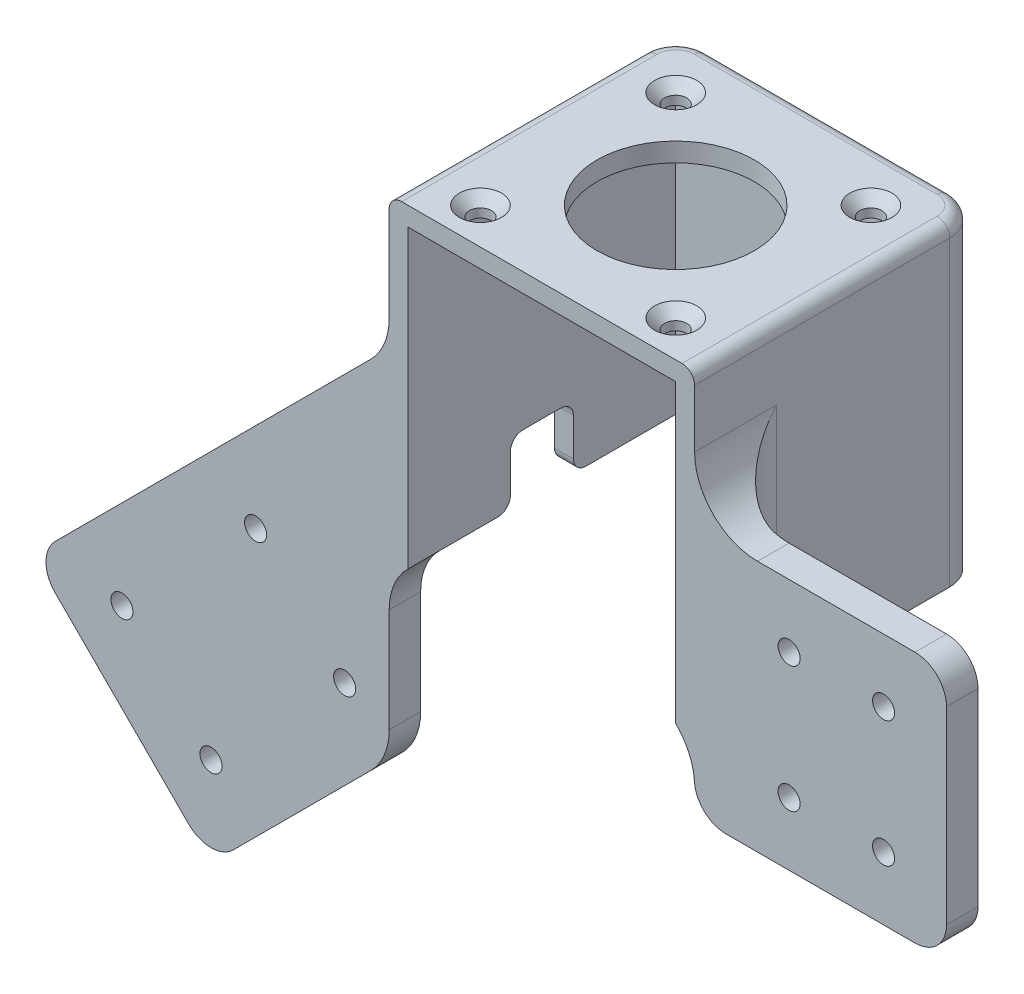
from build123d import *

# Parameters (mm, degrees)
SKETCH1_W                     = 48.5
SKETCH1_H                     = 45.5
BOSS_EXTRUDE1_DEPTH           = 3
BOSS_EXTRUDE2_DEPTH           = 47
SKETCH3_W                     = 5
SKETCH3_H                     = 40
BOSS_EXTRUDE3_DEPTH           = 40
BOSS_EXTRUDE4_DEPTH           = 5
FILLET1_R                     = 8
SKETCH5_R                     = 1.75
SKETCH5_R_2                   = 12.5
CUT_EXTRUDE1_DEPTH            = 134.19002114
SKETCH7_R                     = 1.75
CUT_EXTRUDE2_DEPTH            = 138.083074197
BODY_MOVE_COPY1_START         = -20.75
BODY_MOVE_COPY1_OUTLINE_R     = 1.75
BODY_MOVE_COPY1_DEPTH         = 45
BODY_MOVE_COPY1_START_2       = -33.75
BODY_MOVE_COPY1_2_OUTLINE_R   = 1.75
BODY_MOVE_COPY1_2_DEPTH       = 12.5
BODY_MOVE_COPY1_START_3       = -66.25
BODY_MOVE_COPY1_3_DEPTH       = 36.7500001
BODY_MOVE_COPY1_4_OUTLINE_W   = 42.5
BODY_MOVE_COPY1_4_OUTLINE_H   = 47
BODY_MOVE_COPY1_4_DEPTH       = 3
BODY_MOVE_COPY1_START_4       = -104
BODY_MOVE_COPY1_5_OUTLINE_R   = 1.75
BODY_MOVE_COPY1_5_OUTLINE_R_2 = 12.5
BODY_MOVE_COPY1_5_DEPTH       = 107
BODY_MOVE_COPY1_START_5       = -87.255885421
BODY_MOVE_COPY1_6_DEPTH       = 40.255885421
FILLET2_R                     = 5
FILLET3_START                 = -28.2363
FILLET3_DEPTH                 = 7.4863
FILLET3_START_2               = -33.7500001
FILLET3_2_DEPTH               = 13.0000001
FILLET3_START_3               = -25.75
FILLET3_3_DEPTH               = 5
FILLET3_4_DEPTH               = 8.4719001
FILLET3_START_4               = -47.0000001
FILLET3_5_DEPTH               = 40.0000001
FILLET4_R                     = 5
FILLET5_R                     = 5
FILLET6_R                     = 2
SKETCH8_W                     = 10
SKETCH8_H                     = 10
CUT_EXTRUDE3_DEPTH            = 148.975084215
FILLET7_R                     = 2
CHAMFER1_SIZE                 = 1.6
CHAMFER2_SIZE                 = 1.6


with BuildPart() as part:
    # Sketch1 → Boss-Extrude1 (new body)
    with BuildSketch(Plane(origin=(0, 0, 0), x_dir=(1, 0, 0), z_dir=(0, 1, 0))):
        with Locations((0, -1.5)):
            Rectangle(SKETCH1_W, SKETCH1_H)
    extrude(amount=BOSS_EXTRUDE1_DEPTH)

    # Sketch2 → Boss-Extrude2 (add)
    with BuildSketch(Plane.XZ):
        Polygon((-21.25, 21.25), (21.25, 21.25), (21.25, -21.25), (24.25, -21.25), (24.25, 24.25), (-24.25, 24.25), (-24.25, -21.25), (-21.25, -21.25), align=None)
    extrude(amount=BOSS_EXTRUDE2_DEPTH)

    # Sketch3 → Boss-Extrude3 (add)
    with BuildSketch(Plane(origin=(24.25, 0, 0), x_dir=(0, 0, -1), z_dir=(1, 0, 0))):
        with Locations((18.75, -38.2)):
            Rectangle(SKETCH3_W, SKETCH3_H)
    extrude(amount=BOSS_EXTRUDE3_DEPTH)

    # Sketch4 → Boss-Extrude4 (add)
    with BuildSketch(Plane(origin=(0, 0, -21.25), x_dir=(-1, 0, 0), z_dir=(0, 0, -1))):
        Polygon((24.25, -18.2), (80.818542495, -74.768542495), (52.534271247, -103.052813742), (24.25, -74.768542495), align=None)
    extrude(amount=-BOSS_EXTRUDE4_DEPTH)

    # Fillet1
    fillet1_edges = [part.edges().sort_by_distance(p)[0] for p in [
        (24.25, -32.6, -16.25),
        (-24.25, -32.6, -16.25),
    ]]
    fillet(fillet1_edges, radius=FILLET1_R)

    # Sketch5 → Cut-Extrude1 (cut, through all)
    with BuildSketch(Plane.XZ):
        with Locations(Location((-15.5, 15.5, 0), (0, 0, 270))):
            Circle(SKETCH5_R)
        with Locations(Location((15.5, 15.5, 0), (0, 0, 270))):
            Circle(SKETCH5_R)
        with Locations(Location((15.5, -15.5, 0), (0, 0, 270))):
            Circle(SKETCH5_R)
        with Locations(Location((-15.5, -15.5, 0), (0, 0, 270))):
            Circle(SKETCH5_R)
        with Locations(Location((0, 0, 0), (0, 0, 270))):
            Circle(SKETCH5_R_2)
    extrude(amount=-CUT_EXTRUDE1_DEPTH, mode=Mode.SUBTRACT)

    # Sketch7 → Cut-Extrude2 (cut, through all)
    with BuildSketch(Plane.XY.offset(-16.25)):
        with Locations((54.25, -28.2)):
            Circle(SKETCH7_R)
        with Locations((54.25, -48.2)):
            Circle(SKETCH7_R)
        with Locations((-66.676406871, -74.768542495)):
            Circle(SKETCH7_R)
        with Locations((-52.534271247, -88.910678119)):
            Circle(SKETCH7_R)
        with Locations((39.25, -28.2)):
            Circle(SKETCH7_R)
        with Locations((39.25, -48.2)):
            Circle(SKETCH7_R)
        with Locations((-45.463203436, -53.555339059)):
            Circle(SKETCH7_R)
        with Locations((-31.321067812, -67.697474683)):
            Circle(SKETCH7_R)
    extrude(amount=-CUT_EXTRUDE2_DEPTH, mode=Mode.SUBTRACT)

    # Body-Move/Copy1: read off the stored shape, not the designer's step
    # Body-Move/Copy1 outline → Body-Move/Copy1 (cut)
    with BuildSketch(Plane.XY.offset(BODY_MOVE_COPY1_START)):
        Polygon((-24.25, -74.768542495), (-24.25, -47), (24.25, -47), (24.25, -58.2), (64.25, -58.2), (64.25, -18.2), (24.25, -18.2), (24.25, 3), (-24.25, 3), (-24.25, -18.2), (-80.818542495, -74.768542495), (-52.534271247, -103.052813742), align=None)
        with Locations((-52.534271247, -88.910678119)):
            Circle(BODY_MOVE_COPY1_OUTLINE_R, mode=Mode.SUBTRACT)
        with Locations((-66.676406871, -74.768542495)):
            Circle(BODY_MOVE_COPY1_OUTLINE_R, mode=Mode.SUBTRACT)
        with Locations((-45.463203436, -53.555339059)):
            Circle(BODY_MOVE_COPY1_OUTLINE_R, mode=Mode.SUBTRACT)
        with Locations((-31.321067812, -67.697474683)):
            Circle(BODY_MOVE_COPY1_OUTLINE_R, mode=Mode.SUBTRACT)
        with Locations((39.25, -48.2)):
            Circle(BODY_MOVE_COPY1_OUTLINE_R, mode=Mode.SUBTRACT)
        with Locations((54.25, -48.2)):
            Circle(BODY_MOVE_COPY1_OUTLINE_R, mode=Mode.SUBTRACT)
        with Locations((39.25, -28.2)):
            Circle(BODY_MOVE_COPY1_OUTLINE_R, mode=Mode.SUBTRACT)
        with Locations((54.25, -28.2)):
            Circle(BODY_MOVE_COPY1_OUTLINE_R, mode=Mode.SUBTRACT)
    extrude(amount=BODY_MOVE_COPY1_DEPTH, mode=Mode.SUBTRACT)

    # Body-Move_Copy1 2 outline → Body-Move_Copy1 2 (add)
    with BuildSketch(Plane.XY.offset(BODY_MOVE_COPY1_START_2)):
        Polygon((-24.25, -74.768542495), (-24.25, -47), (-21.25, -47), (-21.25, 0), (21.25, 0), (21.25, -47), (24.25, -47), (24.25, -58.2), (64.25, -58.2), (64.25, -18.2), (24.25, -18.2), (24.25, 3), (-24.25, 3), (-24.25, -18.2), (-80.818542495, -74.768542495), (-52.534271247, -103.052813742), align=None)
        with Locations((-52.534271247, -88.910678119)):
            Circle(BODY_MOVE_COPY1_2_OUTLINE_R, mode=Mode.SUBTRACT)
        with Locations((-66.676406871, -74.768542495)):
            Circle(BODY_MOVE_COPY1_2_OUTLINE_R, mode=Mode.SUBTRACT)
        with Locations((-45.463203436, -53.555339059)):
            Circle(BODY_MOVE_COPY1_2_OUTLINE_R, mode=Mode.SUBTRACT)
        with Locations((-31.321067812, -67.697474683)):
            Circle(BODY_MOVE_COPY1_2_OUTLINE_R, mode=Mode.SUBTRACT)
        with Locations((39.25, -48.2)):
            Circle(BODY_MOVE_COPY1_2_OUTLINE_R, mode=Mode.SUBTRACT)
        with Locations((54.25, -48.2)):
            Circle(BODY_MOVE_COPY1_2_OUTLINE_R, mode=Mode.SUBTRACT)
        with Locations((39.25, -28.2)):
            Circle(BODY_MOVE_COPY1_2_OUTLINE_R, mode=Mode.SUBTRACT)
        with Locations((54.25, -28.2)):
            Circle(BODY_MOVE_COPY1_2_OUTLINE_R, mode=Mode.SUBTRACT)
    extrude(amount=BODY_MOVE_COPY1_2_DEPTH)

    # Body-Move_Copy1 3 outline → Body-Move_Copy1 3 (add)
    with BuildSketch(Plane.XY.offset(BODY_MOVE_COPY1_START_3)):
        Polygon((-24.25, 3), (-24.25, -47), (-21.25, -47), (-21.25, 0), (21.25, 0), (21.25, -47), (24.25, -47), (24.25, 3), align=None)
    extrude(amount=BODY_MOVE_COPY1_3_DEPTH)

    # Body-Move_Copy1 4 outline → Body-Move_Copy1 4 (add)
    with BuildSketch(Plane.XY.offset(BODY_MOVE_COPY1_START_3)):
        with Locations((0, -23.5)):
            Rectangle(BODY_MOVE_COPY1_4_OUTLINE_W, BODY_MOVE_COPY1_4_OUTLINE_H)
    extrude(amount=BODY_MOVE_COPY1_4_DEPTH)

    # Body-Move_Copy1 5 outline → Body-Move_Copy1 5 (cut)
    with BuildSketch(Plane(origin=(0, 0, 0), x_dir=(1, 0, 0), z_dir=(0, 1, 0)).offset(BODY_MOVE_COPY1_START_4)):
        with BuildLine():
            ThreePointArc((24.25, 33.75), (26.593145751, 28.093145751), (32.25, 25.75))
            Line((32.25, 25.75), (64.25, 25.75))
            Line((64.25, 25.75), (64.25, 33.75))
            Line((64.25, 33.75), (24.25, 33.75))
        make_face()
        with Locations((15.5, 26.5)):
            Circle(BODY_MOVE_COPY1_5_OUTLINE_R)
        with Locations((-15.5, 26.5)):
            Circle(BODY_MOVE_COPY1_5_OUTLINE_R)
        with BuildLine():
            Line((-82, 25.749999997), (-32.25, 25.75))
            ThreePointArc((-32.25, 25.75), (-26.593145751, 28.093145751), (-24.25, 33.75))
            Line((-24.25, 33.75), (-82, 33.75))
            Line((-82, 33.75), (-82, 25.749999997))
        make_face()
        with Locations((-15.5, 57.5)):
            Circle(BODY_MOVE_COPY1_5_OUTLINE_R)
        with Locations((0, 42)):
            Circle(BODY_MOVE_COPY1_5_OUTLINE_R_2)
        with Locations((15.5, 57.5)):
            Circle(BODY_MOVE_COPY1_5_OUTLINE_R)
    extrude(amount=BODY_MOVE_COPY1_5_DEPTH, mode=Mode.SUBTRACT)

    # Body-Move_Copy1 6 outline → Body-Move_Copy1 6 (cut)
    with BuildSketch(Plane(origin=(0, 0, 0), x_dir=(1, 0, 0), z_dir=(0, 1, 0)).offset(BODY_MOVE_COPY1_START_5)):
        with BuildLine():
            Line((24.25, 33.75), (24.25, 25.75))
            Line((24.25, 25.75), (32.25, 25.75))
            ThreePointArc((32.25, 25.75), (26.593145751, 28.093145751), (24.25, 33.75))
        make_face()
        with BuildLine():
            Line((-32.25, 25.75), (-24.25, 25.75))
            Line((-24.25, 25.75), (-24.25, 33.75))
            ThreePointArc((-24.25, 33.75), (-26.593145751, 28.093145751), (-32.25, 25.75))
        make_face()
    extrude(amount=BODY_MOVE_COPY1_6_DEPTH, mode=Mode.SUBTRACT)

    # Fillet2
    fillet2_edges = [part.edges().sort_by_distance(p)[0] for p in [
        (64.25, -18.2, -23.25),
        (64.25, -58.2, -23.25),
        (-80.818542495, -74.768542495, -23.499999999),
        (-52.534271247, -103.052813742, -23.499999999),
    ]]
    fillet(fillet2_edges, radius=FILLET2_R)

    # Fillet3: read off the stored shape, not the designer's step
    # Fillet3 outline → Fillet3 (cut)
    with BuildSketch(Plane.XY.offset(FILLET3_START)):
        with BuildLine():
            ThreePointArc((-24.25, -70.626406871), (-25.011204675, -74.453241195), (-27.178932188, -77.697474683))
            Line((-27.178932188, -77.697474683), (-24.25, -74.768542495))
            Line((-24.25, -74.768542495), (-24.25, -70.626406871))
        make_face()
    extrude(amount=FILLET3_DEPTH, mode=Mode.SUBTRACT)

    # Fillet3 2 outline → Fillet3 2 (add)
    with BuildSketch(Plane.XY.offset(FILLET3_START_2)):
        with BuildLine():
            ThreePointArc((34.25, -18.2), (27.178932188, -15.271067812), (24.25, -8.2))
            Line((24.25, -8.2), (24.25, -18.2))
            Line((24.25, -18.2), (34.25, -18.2))
        make_face()
    extrude(amount=FILLET3_2_DEPTH)

    # Fillet3 3 outline → Fillet3 3 (add)
    with BuildSketch(Plane.XY.offset(FILLET3_START_3)):
        with BuildLine():
            Line((24.25, -47), (21.25, -47))
            ThreePointArc((21.25, -47), (23.469544457, -50.268445083), (24.25, -54.141428429))
            Line((24.25, -54.141428429), (24.25, -47))
        make_face()
        with BuildLine():
            Line((-21.25, -47), (-24.25, -47))
            Line((-24.25, -47), (-24.25, -54.141428429))
            ThreePointArc((-24.25, -54.141428429), (-23.469544457, -50.268445083), (-21.25, -47))
        make_face()
        with BuildLine():
            ThreePointArc((-24.25, -14.057864376), (-25.011204675, -17.8846987), (-27.178932188, -21.128932188))
            Line((-27.178932188, -21.128932188), (-24.25, -18.2))
            Line((-24.25, -18.2), (-24.25, -14.057864376))
        make_face()
    extrude(amount=FILLET3_3_DEPTH)

    # Fillet3 4 outline → Fillet3 4 (add)
    with BuildSketch(Plane.XY.offset(FILLET3_START_2)):
        with BuildLine():
            ThreePointArc((-24.25, -14.057864376), (-25.011204675, -17.8846987), (-27.178932188, -21.128932188))
            Line((-27.178932188, -21.128932188), (-24.25, -18.2))
            Line((-24.25, -18.2), (-24.25, -14.057864376))
        make_face()
    extrude(amount=FILLET3_4_DEPTH)

    # Fillet3 5 outline → Fillet3 5 (cut)
    with BuildSketch(Plane(origin=(0, 0, 0), x_dir=(1, 0, 0), z_dir=(0, 1, 0)).offset(FILLET3_START_4)):
        with BuildLine():
            Line((36, 33.7500001), (24.25, 33.75))
            ThreePointArc((24.25, 33.75), (26.593145751, 28.093145751), (32.25, 25.75))
            Line((32.25, 25.75), (36, 25.749999999))
            Line((36, 25.749999999), (36, 33.7500001))
        make_face()
        with BuildLine():
            Line((-29, 33.7500001), (-29, 26.439904242))
            ThreePointArc((-29, 26.439904242), (-25.541796068, 29.391101057), (-24.25, 33.75))
            Line((-24.25, 33.75), (-29, 33.7500001))
        make_face()
    extrude(amount=FILLET3_5_DEPTH, mode=Mode.SUBTRACT)

    # Fillet4
    fillet4_edges = [part.edges().sort_by_distance(p)[0] for p in [
        (24.25, -58.2, -23.25),
    ]]
    fillet(fillet4_edges, radius=FILLET4_R)

    # Fillet5
    fillet5_edges = [part.edges().sort_by_distance(p)[0] for p in [
        (24.25, -22, -66.25),
        (-24.25, -22, -66.25),
    ]]
    fillet(fillet5_edges, radius=FILLET5_R)

    # Fillet6
    fillet6_edges = [part.edges().sort_by_distance(p)[0] for p in [
        (0, 3, -66.25),
        (24.25, 3, -41),
        (22.785533906, 3, -64.785533906),
        (-22.785533906, 3, -64.785533906),
        (-24.25, 3, -41),
    ]]
    fillet(fillet6_edges, radius=FILLET6_R)

    # Sketch8 → Cut-Extrude3 (cut, through all)
    with BuildSketch(Plane(origin=(-21.25, 0, 0), x_dir=(0, 0, -1), z_dir=(1, 0, 0))):
        with Locations((42, -42)):
            Rectangle(SKETCH8_W, SKETCH8_H)
    extrude(amount=-CUT_EXTRUDE3_DEPTH, mode=Mode.SUBTRACT)

    # Fillet7
    fillet7_edges = [part.edges().sort_by_distance(p)[0] for p in [
        (-22.75, -47, -47),
        (-22.75, -47, -37),
        (-22.75, -37, -37),
        (-22.75, -37, -47),
    ]]
    fillet(fillet7_edges, radius=FILLET7_R)

    # Chamfer1
    chamfer1_edges = [part.edges().sort_by_distance(p)[0] for p in [
        (-17.25, 3, -26.5),
        (13.75, 3, -26.5),
        (13.75, 3, -57.5),
        (-17.25, 3, -57.5),
    ]]
    chamfer(chamfer1_edges, length=CHAMFER1_SIZE)

    # Chamfer2
    # the kernel refuses this chamfer: 1.6 mm, written as the material it takes off along each edge
    with BuildSketch(Plane(origin=(39.25, -28.2, -25.75), x_dir=(1, 0, 0), z_dir=(0, -1, 0))) as chamfer2_piece_1:
        Polygon((1.75, CHAMFER2_SIZE), (1.75 + CHAMFER2_SIZE, 0), (1.75, 0), align=None)
    revolve(axis=Axis((39.25, -28.2, -25.75), (0, 0, 1)), mode=Mode.SUBTRACT)
    with BuildSketch(Plane(origin=(-52.534271247, -88.910678119, -25.749999999), x_dir=(1, 0, 0), z_dir=(0, -1, 0))) as chamfer2_piece_2:
        Polygon((1.75, CHAMFER2_SIZE), (1.75 + CHAMFER2_SIZE, CHAMFER2_SIZE * 1.26256782806e-10), (1.75, 0), align=None)
    revolve(axis=Axis((-52.534271247, -88.910678119, -25.749999999), (0, 0, 1)), mode=Mode.SUBTRACT)
    with BuildSketch(Plane(origin=(-66.676406871, -74.768542495, -25.749999998), x_dir=(1, 0, 0), z_dir=(0, -1, 0))) as chamfer2_piece_3:
        Polygon((1.75, CHAMFER2_SIZE), (1.75 + CHAMFER2_SIZE, CHAMFER2_SIZE * 1.26256782806e-10), (1.75, 0), align=None)
    revolve(axis=Axis((-66.676406871, -74.768542495, -25.749999998), (0, 0, 1)), mode=Mode.SUBTRACT)
    with BuildSketch(Plane(origin=(54.25, -48.2, -25.75), x_dir=(1, 0, 0), z_dir=(0, -1, 0))) as chamfer2_piece_4:
        Polygon((1.75, CHAMFER2_SIZE), (1.75 + CHAMFER2_SIZE, 0), (1.75, 0), align=None)
    revolve(axis=Axis((54.25, -48.2, -25.75), (0, 0, 1)), mode=Mode.SUBTRACT)
    with BuildSketch(Plane(origin=(39.25, -48.2, -25.75), x_dir=(1, 0, 0), z_dir=(0, -1, 0))) as chamfer2_piece_5:
        Polygon((1.75, CHAMFER2_SIZE), (1.75 + CHAMFER2_SIZE, 0), (1.75, 0), align=None)
    revolve(axis=Axis((39.25, -48.2, -25.75), (0, 0, 1)), mode=Mode.SUBTRACT)
    with BuildSketch(Plane(origin=(-31.321067812, -67.697474683, -25.75), x_dir=(-0.5308183932196885, -0.8474855948154328, 0), z_dir=(-0.8474855948154328, 0.5308183932196885, 0))) as chamfer2_piece_6:
        Polygon((1.75, CHAMFER2_SIZE), (1.75 + CHAMFER2_SIZE, 0), (1.75, 0), align=None)
    revolve(axis=Axis((-31.321067812, -67.697474683, -25.75), (0, 0, 1)), revolution_arc=122.060767051, mode=Mode.SUBTRACT)
    with BuildSketch(Plane(origin=(-45.463203436, -53.555339059, -25.749999999), x_dir=(1, 0, 0), z_dir=(0, -1, 0))) as chamfer2_piece_7:
        Polygon((1.75, CHAMFER2_SIZE), (1.75 + CHAMFER2_SIZE, CHAMFER2_SIZE * 1.2625456236e-10), (1.75, 0), align=None)
    revolve(axis=Axis((-45.463203436, -53.555339059, -25.749999999), (0, 0, 1)), mode=Mode.SUBTRACT)
    with BuildSketch(Plane(origin=(54.25, -28.2, -25.75), x_dir=(1, 0, 0), z_dir=(0, -1, 0))) as chamfer2_piece_8:
        Polygon((1.75, CHAMFER2_SIZE), (1.75 + CHAMFER2_SIZE, 0), (1.75, 0), align=None)
    revolve(axis=Axis((54.25, -28.2, -25.75), (0, 0, 1)), mode=Mode.SUBTRACT)
    with BuildSketch(Plane(origin=(-31.321067812, -67.697474683, -25.75), x_dir=(-0.5308183932196848, 0.8474855948154352, 0), z_dir=(0.8474855948154352, 0.5308183932196848, 0))) as chamfer2_piece_9:
        Polygon((1.75, CHAMFER2_SIZE), (1.75 + CHAMFER2_SIZE, CHAMFER2_SIZE * 1.26256782806e-10), (1.75, 0), align=None)
    revolve(axis=Axis((-31.321067812, -67.697474683, -25.75), (0, 0, 1)), revolution_arc=115.878465898, mode=Mode.SUBTRACT)
    with BuildSketch(Plane(origin=(-31.321067812, -67.697474683, -25.75), x_dir=(1, 0, 0), z_dir=(0, -1, 0))) as chamfer2_piece_10:
        Polygon((1.75, CHAMFER2_SIZE), (1.75 + CHAMFER2_SIZE, 0), (1.75, 0), align=None)
    revolve(axis=Axis((-31.321067812, -67.697474683, -25.75), (0, 0, 1)), revolution_arc=122.060767051, mode=Mode.SUBTRACT)


solid = part.part
